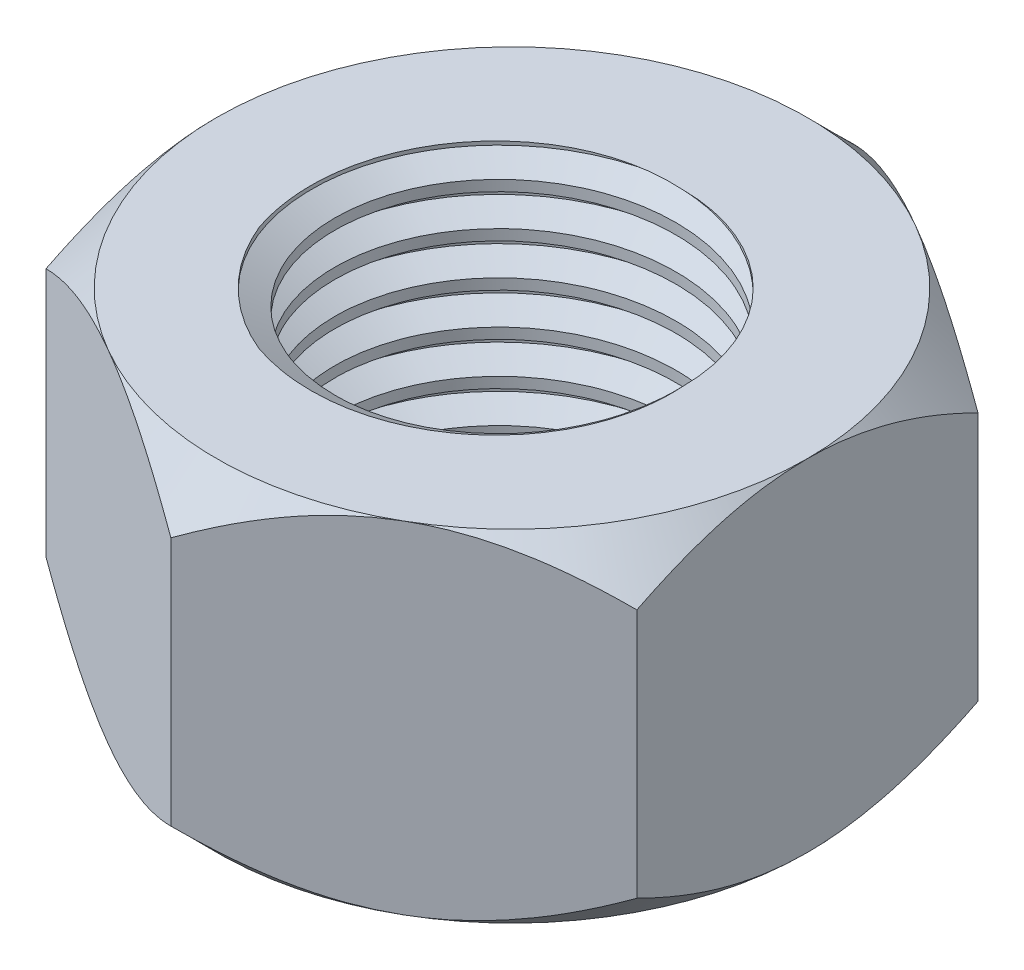
from build123d import *

# Parameters (mm, degrees)
SKETCH1_R               = 5
BOSS_EXTRUDE1_DEPTH     = 5
SKETCH3_OUTSIDE_W       = 44.976
SKETCH3_OUTSIDE_H       = 47.656
SKETCH3_OUTSIDE_R       = 8.660254038
CUT_EXTRUDE2_DEPTH      = 10
CUT_EXTRUDE2_DRAFT      = -45
MIRROR1_COPY_1_SKETCH_W = 44.976
MIRROR1_COPY_1_SKETCH_H = 47.656
MIRROR1_COPY_1_SKETCH_R = 8.660254038
MIRROR1_COPY_1_DEPTH    = 10
MIRROR1_COPY_1_DRAFT    = -45
THREAD1_PITCH           = 1.25


with BuildPart() as part:
    # Sketch1 → Boss-Extrude1 (new, symmetric)
    with BuildSketch(Plane(origin=(0, 0, 0), x_dir=(1, 0, 0), z_dir=(0, 1, 0))):
        Polygon((8.660254038, -5), (8.660254038, 5), (0, 10), (-8.660254038, 5), (-8.660254038, -5), (0, -10), align=None)
        with Locations(Location((0, 0, 0), (0, 0, 270))):
            Circle(SKETCH1_R, mode=Mode.SUBTRACT)
    extrude(amount=BOSS_EXTRUDE1_DEPTH, both=True)


with BuildPart() as cut_extrude2_tool:
    # Sketch3 outside → Cut-Extrude2 (with draft: the straight prism first)
    with BuildSketch(Plane.XZ.offset(5)):
        Rectangle(SKETCH3_OUTSIDE_W, SKETCH3_OUTSIDE_H)
        Circle(SKETCH3_OUTSIDE_R, mode=Mode.SUBTRACT)
    extrude(amount=-CUT_EXTRUDE2_DEPTH)
    # Cut-Extrude2: the draft: its side faces are tilted about the plane it starts from
    cut_extrude2_sides = [cut_extrude2_tool.faces().sort_by_distance(p)[0] for p in [
        (0, 0, -23.828),
        (22.488, 0, 0),
        (0, 0, 23.828),
        (-22.488, 0, 0),
        (-8.660254038, 0, 0),
    ]]
    draft(cut_extrude2_sides, Plane.XZ.offset(5), CUT_EXTRUDE2_DRAFT)


with BuildPart() as part_1:
    add(part.part)

    # Cut-Extrude2: cut by cut_extrude2_tool
    add(cut_extrude2_tool.part, mode=Mode.SUBTRACT)


with BuildPart() as mirror1_copy_1_tool:
    # Mirror1 copy 1 sketch → Mirror1 copy 1 (with draft: the straight prism first)
    with BuildSketch(Plane(origin=(0, 5, 0), x_dir=(1, 0, 0), z_dir=(0, 1, 0))):
        Rectangle(MIRROR1_COPY_1_SKETCH_W, MIRROR1_COPY_1_SKETCH_H)
        Circle(MIRROR1_COPY_1_SKETCH_R, mode=Mode.SUBTRACT)
    extrude(amount=-MIRROR1_COPY_1_DEPTH)
    # Mirror1 copy 1: the draft: its side faces are tilted about the plane it starts from
    mirror1_copy_1_sides = [mirror1_copy_1_tool.faces().sort_by_distance(p)[0] for p in [
        (0, 0, -23.828),
        (22.488, 0, 0),
        (0, 0, 23.828),
        (-22.488, 0, 0),
        (-8.660254038, 0, 0),
    ]]
    draft(mirror1_copy_1_sides, Plane(origin=(0, 5, 0), x_dir=(1, 0, 0), z_dir=(0, 1, 0)), MIRROR1_COPY_1_DRAFT)


with BuildPart() as part_2:
    add(part_1.part)

    # Mirror1 copy 1: cut by mirror1_copy_1_tool
    add(mirror1_copy_1_tool.part, mode=Mode.SUBTRACT)

    # Thread1: the profile of Thread Profile1 profile screwed along a right-hand helix of 8 turns, 8 arcs to a turn; built about Z, then put on its axis
    thread1_z = Axis((0, 0, 0), (0, 0, 1))
    thread1_corners = [(4.9997, 0, -0.000173205), (5.676582344, 0, 0.390624998), (5.676582344, 0, 0.546874998), (4.9997, 0, 0.937673202)]
    with BuildLine(mode=Mode.PRIVATE) as thread1_profile:
        Line(thread1_corners[0], thread1_corners[1])
        Line(thread1_corners[1], thread1_corners[2])
        Line(thread1_corners[2], thread1_corners[3])
        Line(thread1_corners[3], thread1_corners[0])
    thread1_cap = Face(thread1_profile.wire())
    thread1_turn_angles = [0, 22.5, 45, 67.5, 90, 112.5, 135, 157.5, 180, 202.5, 225, 247.5, 270, 292.5, 315, 337.5, 360]
    thread1_turn_weights = [1, 0.9238795325112867, 1, 0.9238795325112867, 1, 0.9238795325112867, 1, 0.9238795325112867, 1, 0.9238795325112867, 1, 0.9238795325112867, 1, 0.9238795325112867, 1, 0.9238795325112867, 1]
    thread1_turn_rails = [Edge.make_bspline([Vector(p[0], p[1], 0).rotate(thread1_z, thread1_turn_angles[k]) / thread1_turn_weights[k] + Vector(0, 0, p[2] + THREAD1_PITCH * thread1_turn_angles[k] / 360) for k in range(17)], [0, 0, 0, 1, 1, 2, 2, 3, 3, 4, 4, 5, 5, 6, 6, 7, 7, 8, 8, 8], 2, thread1_turn_weights) for p in thread1_corners]
    thread1_turn_sides = [Face.make_surface_from_curves(thread1_turn_rails[p[0]], thread1_turn_rails[p[1]]) for p in [(0, 1), (1, 2), (2, 3), (3, 0)]]
    thread1 = Plane(origin=(0, -5, 0), x_dir=(1, 0, 0), z_dir=(0, 1, 0)) * Solid(Shell([*[p.moved(Location((0, 0, THREAD1_PITCH * i))) for i in range(8) for p in thread1_turn_sides], thread1_cap, thread1_cap.rotate(thread1_z, 2880).moved(Location((0, 0, THREAD1_PITCH * 2880 / 360)))]))
    add(thread1, mode=Mode.SUBTRACT)


solid = part_2.part
